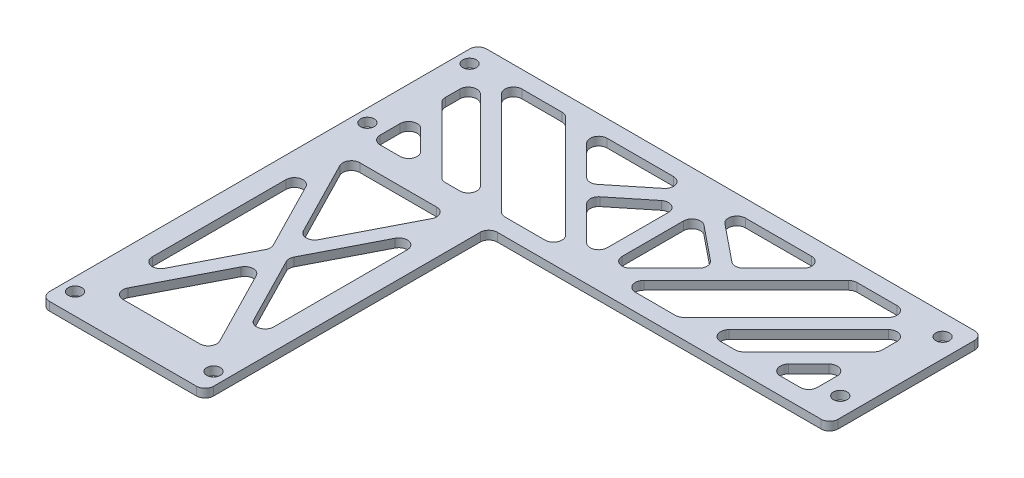
from build123d import *

# Parameters (mm, degrees)
SKETCH_1_W          = 38.5
SKETCH_1_H          = 102.6
EXTRUDE_1_DEPTH     = 2
SKETCH_2_R          = 1.6
CUT_EXTRUDE_1_DEPTH = 2
SKETCH_3_W          = 80
SKETCH_3_H          = 36
EXTRUDE_2_DEPTH     = 2
SKETCH_4_R          = 1.6
SKETCH_4_W          = 28.5
SKETCH_4_H          = 55.6
SKETCH_4_W_2        = 102.60113133
SKETCH_4_H_2        = 28
CUT_EXTRUDE_2_DEPTH = 10
EXTRUDE_START       = -2
EXTRUDE_2_2_DEPTH   = 2
FILLET_1_R          = 2
FILLET_2_R          = 2


# Read off the part's stored shape, not the designer's step: 拉伸-薄壁2
with BuildPart() as part:
    # 草图1 → 凸台-拉伸1 (new body)
    with BuildSketch(Plane(origin=(0, 0, 0), x_dir=(1, 0, 0), z_dir=(0, 1, 0))):
        Rectangle(SKETCH_1_W, SKETCH_1_H)
    extrude(amount=EXTRUDE_1_DEPTH)

    # 草图2 → 切除-拉伸1 (cut)
    with BuildSketch(Plane(origin=(0, 2, 0), x_dir=(1, 0, 0), z_dir=(0, 1, 0))):
        with Locations(Location((-16.25, -46.3, 0), (0, 0, 270))):
            Circle(SKETCH_2_R)
        with Locations(Location((16.25, -46.3, 0), (0, 0, 270))):
            Circle(SKETCH_2_R)
        with Locations(Location((-16.25, 22.3, 0), (0, 0, 270))):
            Circle(SKETCH_2_R)
        with Locations(Location((-16.25, 46.3, 0), (0, 0, 270))):
            Circle(SKETCH_2_R)
    extrude(amount=-CUT_EXTRUDE_1_DEPTH, mode=Mode.SUBTRACT)

    # 草图3 → Extrude 2 (add)
    with BuildSketch(Plane(origin=(0, 2, 0), x_dir=(1, 0, 0), z_dir=(0, 1, 0))):
        with Locations((59.25, 33.3)):
            Rectangle(SKETCH_3_W, SKETCH_3_H)
    extrude(amount=-EXTRUDE_2_DEPTH)

    # 草图4 → 切除-拉伸2 (cut)
    with BuildSketch(Plane(origin=(0, 2, 0), x_dir=(1, 0, 0), z_dir=(0, 1, 0))):
        with Locations(Location((94.75, 46.3, 0), (0, 0, 270))):
            Circle(SKETCH_4_R)
        with Locations(Location((94.75, 22.3, 0), (0, 0, 270))):
            Circle(SKETCH_4_R)
        with Locations(Location((-16.25, 22.3, 0), (0, 0, 270))):
            Circle(SKETCH_4_R)
        with Locations(Location((-16.25, 46.3, 0), (0, 0, 270))):
            Circle(SKETCH_4_R)
        with Locations((0, -14.5)):
            Rectangle(SKETCH_4_W, SKETCH_4_H)
        with Locations((39.050565665, 33.3)):
            Rectangle(SKETCH_4_W_2, SKETCH_4_H_2)
    extrude(amount=-CUT_EXTRUDE_2_DEPTH, mode=Mode.SUBTRACT)

    # Extrude 2 2 outline → Extrude 2 2 (add)
    # profile 1 of 6: a face of its own
    with BuildSketch(Plane(origin=(0, 2, 0), x_dir=(1, 0, 0), z_dir=(0, 1, 0)).offset(EXTRUDE_START)):
        Polygon((21.873623978, 35.651249756), (10.224873734, 47.3), (5.275126266, 47.3), (33.275126266, 19.3), (44.826005064, 19.3), (72.826005064, 47.3), (67.876257596, 47.3), (56.227507352, 35.651249756), (41.832509602, 47.3), (36.268621728, 47.3), align=None)
        Polygon((37.300565665, 20.224308069), (24.362218946, 33.162654788), (37.300565665, 43.632650831), align=None, mode=Mode.SUBTRACT)
        Polygon((40.800565665, 43.632650831), (53.738912383, 33.162654788), (40.800565665, 20.224308069), align=None, mode=Mode.SUBTRACT)
    # profile 2 of 6: a face of its own
    with BuildSketch(Plane(origin=(0, 2, 0), x_dir=(1, 0, 0), z_dir=(0, 1, 0)).offset(EXTRUDE_START)):
        Polygon((18.224873734, 19.3), (-9.775126266, 47.3), (-12.25, 47.3), (-12.25, 44.825126266), (13.275126266, 19.3), align=None)
    # profile 3 of 6: a face of its own
    with BuildSketch(Plane(origin=(0, 2, 0), x_dir=(1, 0, 0), z_dir=(0, 1, 0)).offset(EXTRUDE_START)):
        Polygon((87.876257596, 47.3), (59.876257596, 19.3), (64.826005064, 19.3), (90.35113133, 44.825126266), (90.35113133, 47.3), align=None)
    # profile 4 of 6: a face of its own
    with BuildSketch(Plane(origin=(0, 2, 0), x_dir=(1, 0, 0), z_dir=(0, 1, 0)).offset(EXTRUDE_START)):
        Polygon((-0.724873734, 19.3), (4.224873734, 19.3), (-12.25, 35.774873734), (-12.25, 30.825126266), align=None)
    # profile 5 of 6: a face of its own
    with BuildSketch(Plane(origin=(0, 2, 0), x_dir=(1, 0, 0), z_dir=(0, 1, 0)).offset(EXTRUDE_START)):
        Polygon((90.35113133, 35.774873734), (73.876257596, 19.3), (78.826005064, 19.3), (90.35113133, 30.825126266), align=None)
    # profile 6 of 6: a face of its own
    with BuildSketch(Plane(origin=(0, 2, 0), x_dir=(1, 0, 0), z_dir=(0, 1, 0)).offset(EXTRUDE_START)):
        Polygon((-14.25, 13.3), (-14.25, 9.463577763), (-1.966511398, -14.5), (-14.25, -38.463577763), (-14.25, -42.3), (-12.283488602, -42.3), (0, -18.336422237), (12.283488602, -42.3), (14.25, -42.3), (14.25, -38.463577763), (1.966511398, -14.5), (14.25, 9.463577763), (14.25, 13.3), (12.283488602, 13.3), (0, -10.663577763), (-12.283488602, 13.3), align=None)
    extrude(amount=EXTRUDE_2_2_DEPTH)

    # 圆角1
    fillet_1_edges = [part.edges().sort_by_distance(p)[0] for p in [
        (44.826005064, 1, -19.3),
        (33.275126266, 1, -19.3),
        (36.268621728, 1, -47.3),
        (67.876257596, 1, -47.3),
        (41.832509602, 1, -47.3),
        (10.224873734, 1, -47.3),
        (21.873623978, 1, -35.651249756),
        (56.227507352, 1, -35.651249756),
        (5.275126266, 1, -47.3),
        (72.826005064, 1, -47.3),
        (37.300565665, 1, -20.224308069),
        (40.800565665, 1, -43.632650831),
        (40.800565665, 1, -20.224308069),
        (53.738912383, 1, -33.162654788),
        (24.362218946, 1, -33.162654788),
        (37.300565665, 1, -43.632650831),
        (90.35113133, 1, -30.825126266),
        (90.35113133, 1, -35.774873734),
        (73.876257596, 1, -19.3),
        (78.826005064, 1, -19.3),
        (90.35113133, 1, -44.825126266),
        (87.876257596, 1, -47.3),
        (64.826005064, 1, -19.3),
        (59.876257596, 1, -19.3),
        (18.224873734, 1, -19.3),
        (13.275126266, 1, -19.3),
        (-12.25, 1, -44.825126266),
        (-9.775126266, 1, -47.3),
        (4.224873734, 1, -19.3),
        (-0.724873734, 1, -19.3),
        (-12.25, 1, -30.825126266),
        (-12.25, 1, -35.774873734),
        (-12.283488602, 1, 42.3),
        (12.283488602, 1, 42.3),
        (14.25, 1, -9.463577763),
        (14.25, 1, 38.463577763),
        (12.283488602, 1, -13.3),
        (-12.283488602, 1, -13.3),
        (-14.25, 1, 38.463577763),
        (-14.25, 1, -9.463577763),
        (-1.966511398, 1, 14.5),
        (0, 1, 10.663577763),
        (1.966511398, 1, 14.5),
        (0, 1, 18.336422237),
        (-12.25, 1, -19.3),
        (90.35113133, 1, -19.3),
    ]]
    fillet(fillet_1_edges, radius=FILLET_1_R)

    # 圆角2
    fillet_2_edges = [part.edges().sort_by_distance(p)[0] for p in [
        (19.25, 1, -15.3),
        (99.25, 1, -51.3),
        (99.25, 1, -15.3),
        (19.25, 1, 51.3),
        (-19.25, 1, 51.3),
        (-19.25, 1, -51.3),
    ]]
    fillet(fillet_2_edges, radius=FILLET_2_R)


solid = part.part
